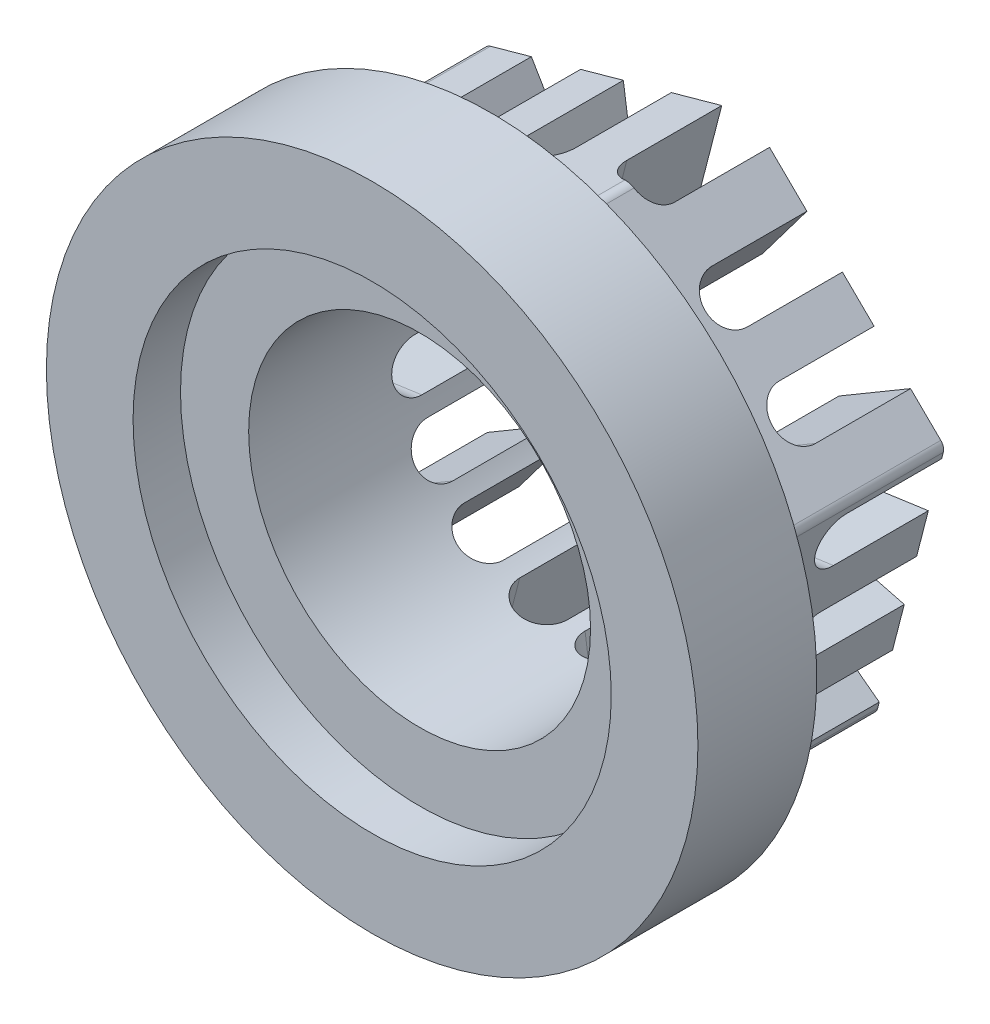
from build123d import *

# Parameters (mm, degrees)
SKETCH1_R           = 21.79955
BOSS_EXTRUDE1_DEPTH = 20.6502
SKETCH2_R           = 11.44016
CUT_EXTRUDE1_DEPTH  = 20.6502
SKETCH3_R           = 16.000000004
CUT_EXTRUDE2_DEPTH  = 3.175
SKETCH4_OUTSIDE_W   = 58.604
SKETCH4_OUTSIDE_H   = 58.604
CUT_EXTRUDE3_DEPTH  = 12.7
CUT_EXTRUDE4_DEPTH  = 9.8552
CIRPATTERN1_COUNT   = 16
FILLET1_R           = 0.635


with BuildPart() as part:
    # Sketch1 → Boss-Extrude1 (new body)
    with BuildSketch(Plane.XY):
        Circle(SKETCH1_R)
    extrude(amount=BOSS_EXTRUDE1_DEPTH)

    # Sketch2 → Cut-Extrude1 (cut)
    with BuildSketch(Plane.XY.offset(20.6502)):
        Circle(SKETCH2_R)
    extrude(amount=-CUT_EXTRUDE1_DEPTH, mode=Mode.SUBTRACT)

    # Sketch3 → Cut-Extrude2 (cut)
    with BuildSketch(Plane.XY.offset(20.6502)):
        Circle(SKETCH3_R)
    extrude(amount=-CUT_EXTRUDE2_DEPTH, mode=Mode.SUBTRACT)

    # Sketch4 outside → Cut-Extrude3 (cut)
    with BuildSketch(Plane(origin=(0, 0, 0), x_dir=(-1, 0, 0), z_dir=(0, 0, -1))):
        Rectangle(SKETCH4_OUTSIDE_W, SKETCH4_OUTSIDE_H)
        Polygon((17.661795398, -4.907322758), (13.080763872, 12.841902112), (-4.581031526, 17.74922487), (-17.661795398, 4.907322758), (-13.080763872, -12.841902112), (4.581031526, -17.74922487), align=None, mode=Mode.SUBTRACT)
    extrude(amount=-CUT_EXTRUDE3_DEPTH, mode=Mode.SUBTRACT)

    # Sketch5 → Cut-Extrude4 (cut, symmetric)
    with BuildSketch(Plane(origin=(-15.371279635, 3.967289677, 0), x_dir=(0, 0, 1), z_dir=(-0.9682695833030739, 0.24990801117629627, 0))):
        with BuildLine():
            Line((6.35, 1.651), (0, 1.651))
            Line((0, 1.651), (0, -1.651))
            Line((0, -1.651), (6.35, -1.651))
            ThreePointArc((6.35, -1.651), (8.001, 0), (6.35, 1.651))
        make_face()
    cut_extrude4 = extrude(amount=CUT_EXTRUDE4_DEPTH, both=True, mode=Mode.SUBTRACT)

    # CirPattern1: Cut-Extrude4 ×16 about axis
    cirpattern1_axis = Axis((0, 0, 17.4752), (0, 0, 1))
    for i in range(1, CIRPATTERN1_COUNT):
        add(cut_extrude4.rotate(cirpattern1_axis, i * 360 / CIRPATTERN1_COUNT), mode=Mode.SUBTRACT)

    # Fillet1
    fillet1_edges = [part.edges().sort_by_distance(p)[0] for p in [
        (-17.661795398, -4.907322758, 6.35),
        (-13.080763872, 12.841902112, 6.35),
        (4.581031526, 17.74922487, 10.3505),
        (17.661795398, 4.907322758, 6.35),
        (13.080763872, -12.841902112, 6.35),
        (-4.581031526, -17.74922487, 10.3505),
    ]]
    fillet(fillet1_edges, radius=FILLET1_R)


solid = part.part
